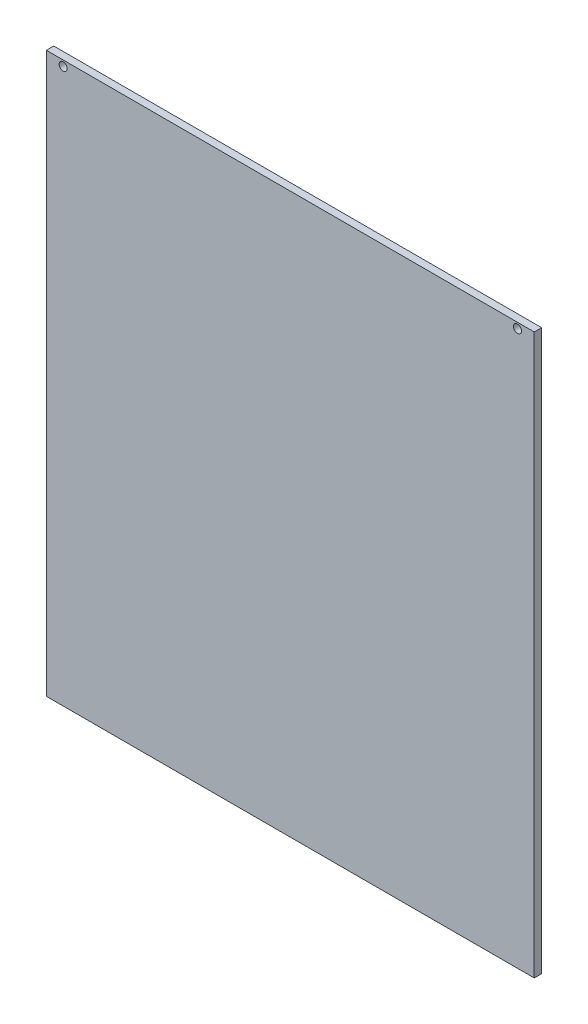
from build123d import *

# Parameters (mm, degrees)
SKETCH1_W           = 218
SKETCH1_H           = 250
SKETCH1_R           = 1.8
BOSS_EXTRUDE1_DEPTH = 3.302


with BuildPart() as part:
    # Sketch1 → Boss-Extrude1 (new body)
    with BuildSketch(Plane.XY):
        with Locations((-27.115183246, 4.882198953)):
            Rectangle(SKETCH1_W, SKETCH1_H)
        with Locations((-128.615183246, 127.382198953)):
            Circle(SKETCH1_R, mode=Mode.SUBTRACT)
        with Locations((74.384816754, 127.382198953)):
            Circle(SKETCH1_R, mode=Mode.SUBTRACT)
    extrude(amount=BOSS_EXTRUDE1_DEPTH)


solid = part.part
